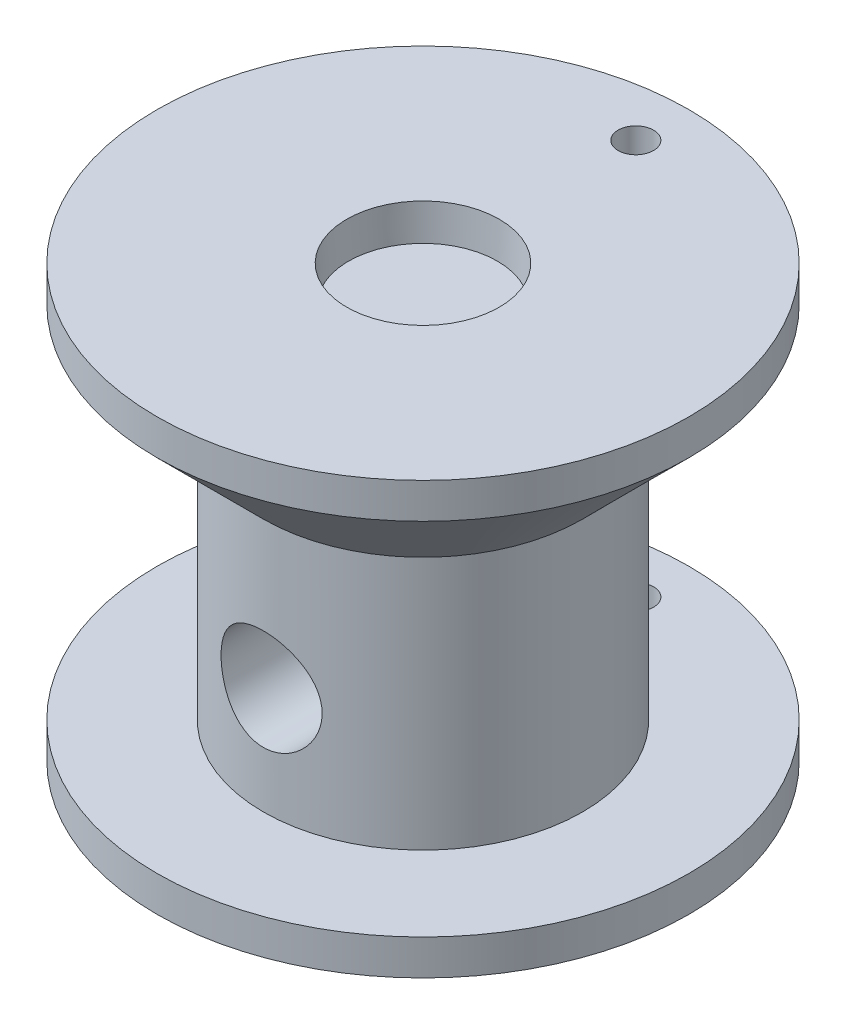
from build123d import *

# Parameters (mm, degrees)
BOSS_EXTRUDE1_REACH     = 18.128
CUT_EXTRUDE1_DEPTH      = 16.389038307
CUT_EXTRUDE1_DEPTH_BACK = 16.389038307
SKETCH5_R               = 0.5
CUT_EXTRUDE2_DEPTH      = 14.094965807
CUT_EXTRUDE2_DEPTH_BACK = 14.094965807
SKETCH6_R               = 1.425


with BuildPart() as part:
    # Sketch1 → Revolve1 (revolve)
    with BuildSketch(Plane(origin=(0, 0, 0), x_dir=(0, 0, -1), z_dir=(1, 0, 0))):
        Polygon((-7.5, 6.075), (-7.5, 5.075), (-4.5, 2.075), (-4.5, -5.075), (-7.5, -5.075), (-7.5, -6.075), (-2.15, -6.075), (-2.15, 1.925), (0, 4.075), (0, 5.075), (-2.1, 5.075), (-2.15, 6.075), align=None)
    revolve(axis=Axis((0, 0, 0), (0, 1, 0)))

    # Sketch2 → Boss-Extrude1 (add, up to next)
    with BuildSketch(Plane.XZ.offset(6.075), mode=Mode.PRIVATE) as boss_extrude1_sk1:
        with BuildLine():
            Line((1.673320053, 1.35), (-1.673320053, 1.35))
            ThreePointArc((-1.673320053, 1.35), (0, 2.15), (1.673320053, 1.35))
        make_face()
    boss_extrude1_tool1 = extrude(boss_extrude1_sk1.sketch, amount=-BOSS_EXTRUDE1_REACH, mode=Mode.PRIVATE) - part.part
    add(boss_extrude1_tool1.solids().sort_by_distance((0, -6.075, 1.675724))[0])

    # Sketch5 → Cut-Extrude1 (cut, two sides: drawn at the far end of the back side and taken through both)
    with BuildSketch(Plane(origin=(0, -5.075, 0), x_dir=(1, 0, 0), z_dir=(0, 1, 0)).offset(-CUT_EXTRUDE1_DEPTH_BACK)):
        with Locations((0, 6)):
            Circle(SKETCH5_R)
    extrude(amount=CUT_EXTRUDE1_DEPTH + CUT_EXTRUDE1_DEPTH_BACK, mode=Mode.SUBTRACT)

    # Sketch6 → Cut-Extrude2 (cut, two sides: drawn at the far end of the back side and taken through both)
    with BuildSketch(Plane(origin=(0, 0, 1.35), x_dir=(-1, 0, 0), z_dir=(0, 0, -1)).offset(-CUT_EXTRUDE2_DEPTH_BACK)):
        with Locations((0, -2.075)):
            Circle(SKETCH6_R)
    extrude(amount=CUT_EXTRUDE2_DEPTH + CUT_EXTRUDE2_DEPTH_BACK, mode=Mode.SUBTRACT)


solid = part.part
